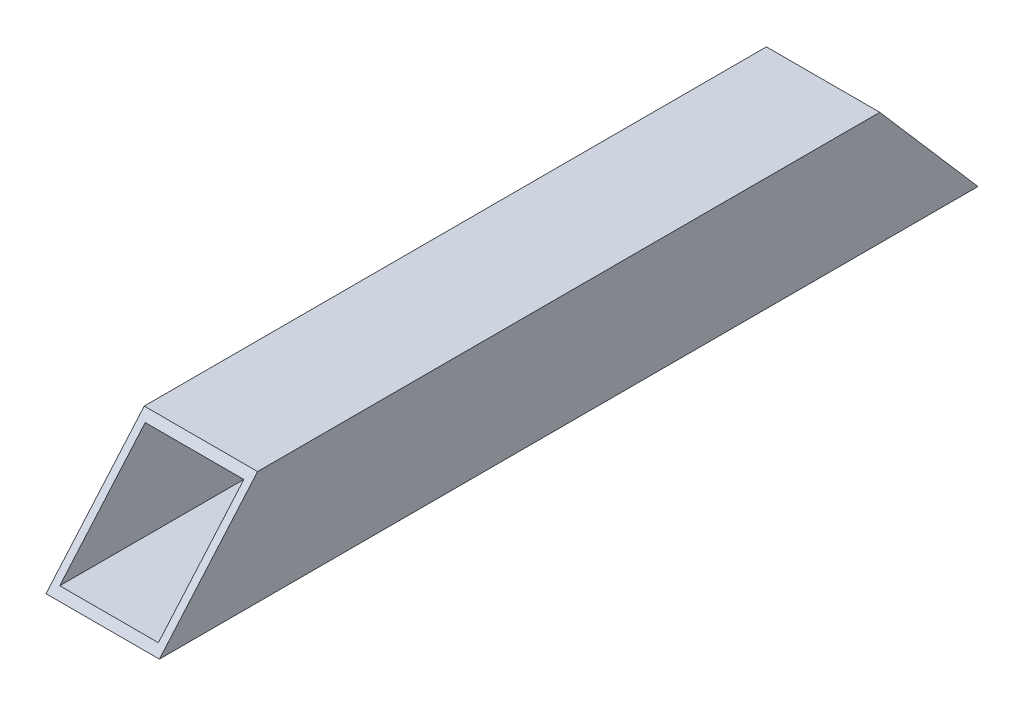
from build123d import *

# Parameters (mm, degrees)
SKETCH1_W           = 25.4
SKETCH1_H           = 25.4
BOSS_EXTRUDE1_DEPTH = 183.4
CUT_EXTRUDE1_DEPTH  = 224.6
CUT_EXTRUDE2_DEPTH  = 224.6
SHELL1_T            = -1.651


with BuildPart() as part:
    # Sketch1 → Boss-Extrude1 (new body)
    with BuildSketch(Plane.XY):
        with Locations((12.7, 12.7)):
            Rectangle(SKETCH1_W, SKETCH1_H)
    extrude(amount=BOSS_EXTRUDE1_DEPTH)

    # Sketch2 → Cut-Extrude1 (cut)
    with BuildSketch(Plane(origin=(25.4, 0, 0), x_dir=(0, 0, -1), z_dir=(1, 0, 0))):
        Polygon((-183.4, 0), (-161.395604018, 25.4), (-183.4, 25.4), align=None)
    extrude(amount=-CUT_EXTRUDE1_DEPTH, mode=Mode.SUBTRACT)

    # Sketch3 → Cut-Extrude2 (cut)
    with BuildSketch(Plane(origin=(25.4, 0, 0), x_dir=(0, 0, -1), z_dir=(1, 0, 0))):
        Polygon((0, 0), (-22.004395982, 25.4), (0, 25.4), align=None)
    extrude(amount=-CUT_EXTRUDE2_DEPTH, mode=Mode.SUBTRACT)

    # Shell1
    shell1_openings = [part.faces().sort_by_distance(p)[0] for p in [
        (12.7, 12.7, 172.397802009),
        (12.7, 12.7, 11.002197991),
    ]]
    offset(amount=SHELL1_T, openings=shell1_openings, kind=Kind.INTERSECTION)


solid = part.part
